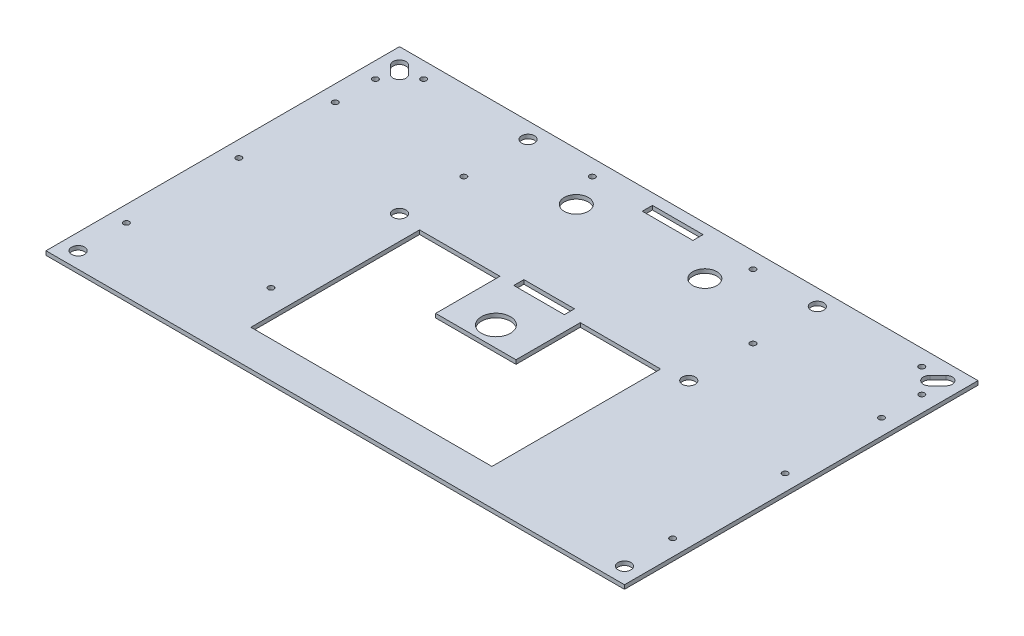
from build123d import *

# Parameters (mm, degrees)
SKETCH1_W           = 457.2
SKETCH1_H           = 279.4
BOSS_EXTRUDE1_DEPTH = 3.175
SKETCH2_R           = 5.08
SKETCH2_R_2         = 11.43
SKETCH2_W           = 8
SKETCH2_H           = 8
CUT_EXTRUDE1_DEPTH  = 3.175
SKETCH3_W           = 40
SKETCH3_H           = 8
CUT_EXTRUDE2_DEPTH  = 25.4
SKETCH4_R           = 2.25
CUT_EXTRUDE3_DEPTH  = 25.4
SKETCH5_R           = 9.525
CUT_EXTRUDE4_DEPTH  = 101.6
SKETCH6_R           = 2.25
CUT_EXTRUDE5_DEPTH  = 637.032
CUT_EXTRUDE6_DEPTH  = 25.4


with BuildPart() as part:
    # Sketch1 → Boss-Extrude1 (new body)
    with BuildSketch(Plane(origin=(0, 0, 0), x_dir=(1, 0, 0), z_dir=(0, 1, 0))):
        Rectangle(SKETCH1_W, SKETCH1_H)
    extrude(amount=BOSS_EXTRUDE1_DEPTH)

    # Sketch2 → Cut-Extrude1 (cut)
    with BuildSketch(Plane(origin=(0, 3.175, 0), x_dir=(1, 0, 0), z_dir=(0, 1, 0))):
        with Locations((-114.3, 127)):
            Circle(SKETCH2_R)
        with Locations((114.3, 127)):
            Circle(SKETCH2_R)
        with Locations((-215.9, -127)):
            Circle(SKETCH2_R)
        with Locations((215.9, -127)):
            Circle(SKETCH2_R)
        with Locations((114.3, 25.4)):
            Circle(SKETCH2_R)
        with Locations((-114.3, 25.4)):
            Circle(SKETCH2_R)
        with Locations((0, -12.7)):
            Circle(SKETCH2_R_2)
        with BuildLine():
            Line((-212.307897552, 130.592102448), (-205.957897552, 124.242102448))
            ThreePointArc((-205.957897552, 124.242102448), (-205.957897552, 117.057897552), (-213.142102448, 117.057897552))
            Line((-213.142102448, 117.057897552), (-219.492102448, 123.407897552))
            ThreePointArc((-219.492102448, 123.407897552), (-219.492102448, 130.592102448), (-212.307897552, 130.592102448))
        make_face()
        with BuildLine():
            Line((212.307897552, 130.592102448), (205.957897552, 124.242102448))
            ThreePointArc((205.957897552, 124.242102448), (205.957897552, 117.057897552), (213.142102448, 117.057897552))
            Line((213.142102448, 117.057897552), (219.492102448, 123.407897552))
            ThreePointArc((219.492102448, 123.407897552), (219.492102448, 130.592102448), (212.307897552, 130.592102448))
        make_face()
        with Locations((-16, 127)):
            Rectangle(SKETCH2_W, SKETCH2_H)
        with Locations((16, 127)):
            Rectangle(SKETCH2_W, SKETCH2_H)
        with Locations((16, 25.4)):
            Rectangle(SKETCH2_W, SKETCH2_H)
        with Locations((-16, 25.4)):
            Rectangle(SKETCH2_W, SKETCH2_H)
    extrude(amount=-CUT_EXTRUDE1_DEPTH, mode=Mode.SUBTRACT)

    # Sketch3 → Cut-Extrude2 (cut)
    with BuildSketch(Plane(origin=(0, 3.175, 0), x_dir=(1, 0, 0), z_dir=(0, 1, 0))):
        with Locations((0, 127)):
            Rectangle(SKETCH3_W, SKETCH3_H)
        with Locations((0, 25.4)):
            Rectangle(SKETCH3_W, SKETCH3_H)
    extrude(amount=-CUT_EXTRUDE2_DEPTH, mode=Mode.SUBTRACT)

    # Sketch4 → Cut-Extrude3 (cut)
    with BuildSketch(Plane(origin=(0, 3.175, 0), x_dir=(1, 0, 0), z_dir=(0, 1, 0))):
        with Locations((-196.85, 127)):
            Circle(SKETCH4_R)
        with Locations((-215.9, 107.95)):
            Circle(SKETCH4_R)
        with Locations((196.85, 127)):
            Circle(SKETCH4_R)
        with Locations((215.9, 107.95)):
            Circle(SKETCH4_R)
    extrude(amount=-CUT_EXTRUDE3_DEPTH, mode=Mode.SUBTRACT)

    # Sketch5 → Cut-Extrude4 (cut)
    with BuildSketch(Plane(origin=(0, 3.175, 0), x_dir=(1, 0, 0), z_dir=(0, 1, 0))):
        with Locations((-50.8, 101.6)):
            Circle(SKETCH5_R)
        with Locations((50.8, 101.6)):
            Circle(SKETCH5_R)
    extrude(amount=-CUT_EXTRUDE4_DEPTH, mode=Mode.SUBTRACT)

    # Sketch6 → Cut-Extrude5 (cut)
    with BuildSketch(Plane(origin=(0, 3.175, 0), x_dir=(1, 0, 0), z_dir=(0, 1, 0))):
        with Locations((-215.9, 76.2)):
            Circle(SKETCH6_R)
        with Locations((-215.9, 0)):
            Circle(SKETCH6_R)
        with Locations((-215.9, -88.9)):
            Circle(SKETCH6_R)
        with Locations((-114.3, -76.2)):
            Circle(SKETCH6_R)
        with Locations((-114.3, 76.2)):
            Circle(SKETCH6_R)
        with Locations((-63.5, 127)):
            Circle(SKETCH6_R)
        with Locations((63.5, 127)):
            Circle(SKETCH6_R)
        with Locations((114.3, 76.2)):
            Circle(SKETCH6_R)
        with Locations((215.9, -88.9)):
            Circle(SKETCH6_R)
        with Locations((215.9, 0)):
            Circle(SKETCH6_R)
        with Locations((215.9, 76.2)):
            Circle(SKETCH6_R)
    extrude(amount=-CUT_EXTRUDE5_DEPTH, mode=Mode.SUBTRACT)

    # Sketch7 → Cut-Extrude6 (cut)
    with BuildSketch(Plane(origin=(0, 3.175, 0), x_dir=(1, 0, 0), z_dir=(0, 1, 0))):
        Polygon((-95.25, -111.125), (95.25, -111.125), (95.25, 22.225), (31.75, 22.225), (31.75, -28.575), (-31.75, -28.575), (-31.75, 22.225), (-95.25, 22.225), align=None)
    extrude(amount=-CUT_EXTRUDE6_DEPTH, mode=Mode.SUBTRACT)


solid = part.part
